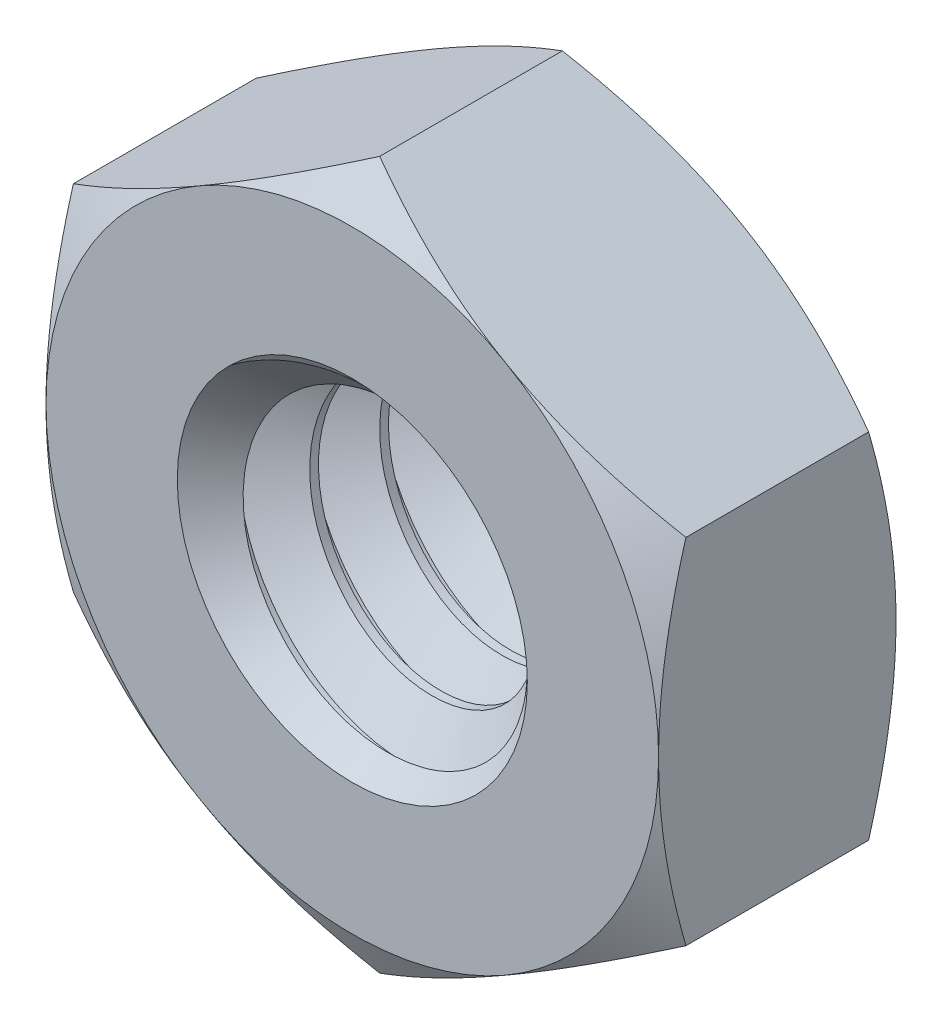
from build123d import *

# Parameters (mm, degrees)
EXTRUDE1_DEPTH          = 5.55625
SKETCH2_OUTSIDE_W       = 55.29
SKETCH2_OUTSIDE_H       = 57.01
SKETCH2_OUTSIDE_R       = 5.55625
CUT_EXTRUDE1_DEPTH      = 11.1442782
CUT_EXTRUDE1_DRAFT      = -60
SKETCH4_R               = 3.175
CUT_EXTRUDE3_DEPTH      = 11.1442782
SWEEP1_PITCH            = 1.27
CUT_EXTRUDE8_DEPTH      = 11.891947653
CUT_EXTRUDE9_DEPTH      = 11.144278373
SKETCH12_OUTSIDE_W      = 16.684
SKETCH12_OUTSIDE_H      = 18.404
SKETCH12_OUTSIDE_R      = 3.81
CUT_EXTRUDE10_DEPTH     = 1.25015625
SKETCH15_W              = 0.381
SKETCH15_H              = 6.415804866
CUT_EXTRUDE_THIN2_DEPTH = 0.74215625
CIRPATTERN1_COUNT       = 6
SKETCH3_OUTSIDE_W       = 53.116
SKETCH3_OUTSIDE_H       = 54.836
SKETCH3_OUTSIDE_R       = 5.55625
CUT_EXTRUDE2_DEPTH      = 10.517190316
CUT_EXTRUDE2_DRAFT      = -60


with BuildPart() as part:
    # Sketch1 → Extrude1 (new body)
    with BuildSketch(Plane.XY):
        Polygon((0, 6.415804866), (-5.55625, 3.207902433), (-5.55625, -3.207902433), (0, -6.415804866), (5.55625, -3.207902433), (5.55625, 3.207902433), align=None)
    extrude(amount=-EXTRUDE1_DEPTH)


with BuildPart() as cut_extrude1_tool:
    # Sketch2 outside → Cut-Extrude1 (with draft: the straight prism first)
    with BuildSketch(Plane.XY):
        Rectangle(SKETCH2_OUTSIDE_W, SKETCH2_OUTSIDE_H)
        Circle(SKETCH2_OUTSIDE_R, mode=Mode.SUBTRACT)
    extrude(amount=-CUT_EXTRUDE1_DEPTH)
    # Cut-Extrude1: the draft: its side faces are tilted about the plane it starts from
    cut_extrude1_sides = [cut_extrude1_tool.faces().sort_by_distance(p)[0] for p in [
        (0, -28.505, -5.5721391),
        (27.645, 0, -5.5721391),
        (0, 28.505, -5.5721391),
        (-27.645, 0, -5.5721391),
        (-5.55625, 0, -5.5721391),
    ]]
    draft(cut_extrude1_sides, Plane.XY, CUT_EXTRUDE1_DRAFT)


with BuildPart() as part_1:
    add(part.part)

    # Cut-Extrude1: cut by cut_extrude1_tool
    add(cut_extrude1_tool.part, mode=Mode.SUBTRACT)

    # Sketch4 → Cut-Extrude3 (cut, through all)
    with BuildSketch(Plane.XY):
        Circle(SKETCH4_R)
    extrude(amount=-CUT_EXTRUDE3_DEPTH, mode=Mode.SUBTRACT)

    # Sweep1: the profile of Sketch9 profile screwed along a right-hand helix of 5.375 turns, 6 arcs to a turn; built about Z, then put on its axis
    sweep1_z = Axis((0, 0, 0), (0, 0, 1))
    sweep1_corners = [(2.350110803, 0, -0.635), (2.350110803, 0, -0.47625), (3.1753, 0, 0.000173205), (3.1753, 0, -1.111423205)]
    with BuildLine(mode=Mode.PRIVATE) as sweep1_profile:
        Line(sweep1_corners[0], sweep1_corners[1])
        Line(sweep1_corners[1], sweep1_corners[2])
        Line(sweep1_corners[2], sweep1_corners[3])
        Line(sweep1_corners[3], sweep1_corners[0])
    sweep1_cap = Face(sweep1_profile.wire())
    sweep1_turn_angles = [0, 30, 60, 90, 120, 150, 180, 210, 240, 270, 300, 330, 360]
    sweep1_turn_weights = [1, 0.8660254037844387, 1, 0.8660254037844387, 1, 0.8660254037844387, 1, 0.8660254037844387, 1, 0.8660254037844387, 1, 0.8660254037844387, 1]
    sweep1_turn_rails = [Edge.make_bspline([Vector(p[0], p[1], 0).rotate(sweep1_z, sweep1_turn_angles[k]) / sweep1_turn_weights[k] + Vector(0, 0, p[2] + SWEEP1_PITCH * sweep1_turn_angles[k] / 360) for k in range(13)], [0, 0, 0, 1, 1, 2, 2, 3, 3, 4, 4, 5, 5, 6, 6, 6], 2, sweep1_turn_weights) for p in sweep1_corners]
    sweep1_turn_sides = [Face.make_surface_from_curves(sweep1_turn_rails[p[0]], sweep1_turn_rails[p[1]]) for p in [(0, 1), (1, 2), (2, 3), (3, 0)]]
    sweep1_last_angles = [1800, 1830, 1860, 1890, 1920, 1927.5, 1935]
    sweep1_last_weights = [1, 0.8660254037844387, 1, 0.8660254037844387, 1, 0.9914448613738068, 1]
    sweep1_last_rails = [Edge.make_bspline([Vector(p[0], p[1], 0).rotate(sweep1_z, sweep1_last_angles[k]) / sweep1_last_weights[k] + Vector(0, 0, p[2] + SWEEP1_PITCH * sweep1_last_angles[k] / 360) for k in range(7)], [0, 0, 0, 1, 1, 2, 2, 3, 3, 3], 2, sweep1_last_weights) for p in sweep1_corners]
    sweep1_last_sides = [Face.make_surface_from_curves(sweep1_last_rails[p[0]], sweep1_last_rails[p[1]]) for p in [(0, 1), (1, 2), (2, 3), (3, 0)]]
    sweep1 = Plane(origin=(0, 0, 0), x_dir=(0, 1, 0), z_dir=(0, 0, -1)) * Solid(Shell([*[p.moved(Location((0, 0, SWEEP1_PITCH * i))) for i in range(5) for p in sweep1_turn_sides], *sweep1_last_sides, sweep1_cap, sweep1_cap.rotate(sweep1_z, 1935).moved(Location((0, 0, SWEEP1_PITCH * 1935 / 360)))]))
    add(sweep1)

    # Sketch10 → Cut-Extrude8 (cut, through all)
    with BuildSketch(Plane.XY):
        Polygon((0, 6.415804866), (-5.55625, 3.207902433), (-5.55625, -3.207902433), (0, -6.415804866), (5.55625, -3.207902433), (5.55625, 3.207902433), align=None)
    extrude(amount=CUT_EXTRUDE8_DEPTH, mode=Mode.SUBTRACT)

    # Sketch11 → Cut-Extrude9 (cut, through all)
    with BuildSketch(Plane(origin=(0, 0, -5.55625), x_dir=(-1, 0, 0), z_dir=(0, 0, -1))):
        Polygon((5.55625, 3.207902433), (0, 6.415804866), (-5.55625, 3.207902433), (-5.55625, -3.207902433), (0, -6.415804866), (5.55625, -3.207902433), align=None)
    extrude(amount=CUT_EXTRUDE9_DEPTH, mode=Mode.SUBTRACT)

    # Sketch12 outside → Cut-Extrude10 (cut)
    with BuildSketch(Plane(origin=(0, 0, -5.55625), x_dir=(-1, 0, 0), z_dir=(0, 0, -1))):
        Rectangle(SKETCH12_OUTSIDE_W, SKETCH12_OUTSIDE_H)
        Circle(SKETCH12_OUTSIDE_R, mode=Mode.SUBTRACT)
    extrude(amount=-CUT_EXTRUDE10_DEPTH, mode=Mode.SUBTRACT)

    # Sketch15 → Cut-Extrude-Thin2 (cut)
    with BuildSketch(Plane(origin=(0, 0, -5.55625), x_dir=(-1, 0, 0), z_dir=(0, 0, -1))):
        with Locations((0, -3.207902433)):
            Rectangle(SKETCH15_W, SKETCH15_H)
    cut_extrude_thin2 = extrude(amount=-CUT_EXTRUDE_THIN2_DEPTH, mode=Mode.SUBTRACT)

    # CirPattern1: Cut-Extrude-Thin2 ×6 about axis
    cirpattern1_axis = Axis((0, 0, 0), (0, 0, 1))
    for i in range(1, CIRPATTERN1_COUNT):
        add(cut_extrude_thin2.rotate(cirpattern1_axis, i * 360 / CIRPATTERN1_COUNT), mode=Mode.SUBTRACT)


with BuildPart() as cut_extrude2_tool:
    # Sketch3 outside → Cut-Extrude2 (with draft: the straight prism first)
    with BuildSketch(Plane(origin=(0, 0, -4.30609375), x_dir=(-1, 0, 0), z_dir=(0, 0, -1))):
        Rectangle(SKETCH3_OUTSIDE_W, SKETCH3_OUTSIDE_H)
        Circle(SKETCH3_OUTSIDE_R, mode=Mode.SUBTRACT)
    extrude(amount=-CUT_EXTRUDE2_DEPTH)
    # Cut-Extrude2: the draft: its side faces are tilted about the plane it starts from
    cut_extrude2_sides = [cut_extrude2_tool.faces().sort_by_distance(p)[0] for p in [
        (0, -27.418, 0.952501408),
        (-26.558, 0, 0.952501408),
        (0, 27.418, 0.952501408),
        (26.558, 0, 0.952501408),
        (5.55625, 0, 0.952501408),
    ]]
    draft(cut_extrude2_sides, Plane(origin=(0, 0, -4.30609375), x_dir=(-1, 0, 0), z_dir=(0, 0, -1)), CUT_EXTRUDE2_DRAFT)


with BuildPart() as part_2:
    add(part_1.part)

    # Cut-Extrude2: cut by cut_extrude2_tool
    add(cut_extrude2_tool.part, mode=Mode.SUBTRACT)

    # Cut-Extrude6 cone 1 section (through the dimple's axis) → Cut-Extrude6 (revolve, cut)
    with BuildSketch(Plane(origin=(0, 0, 0), x_dir=(0, -1, 0), z_dir=(1, 0, 0))):
        Polygon((0, 0), (3.175, 0), (0, 3.175), align=None)
    revolve(axis=Axis((0, 0, 0), (0, 0, -1)), mode=Mode.SUBTRACT)

    # Cut-Extrude7 cone 1 section (through the dimple's axis) → Cut-Extrude7 (revolve, cut)
    with BuildSketch(Plane(origin=(0, 0, -5.55625), x_dir=(0, 1, 0), z_dir=(1, 0, 0))):
        Polygon((0, 0), (3.175, 0), (0, 3.175), align=None)
    revolve(axis=Axis((0, 0, -5.55625), (0, 0, 1)), mode=Mode.SUBTRACT)


solid = part_2.part
